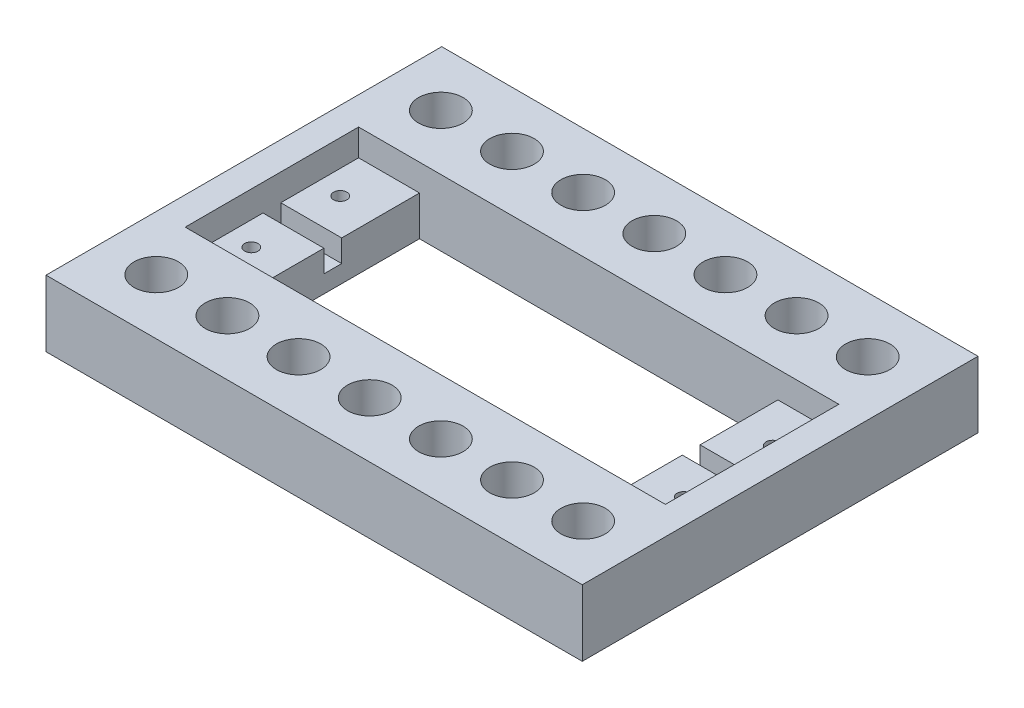
from build123d import *

# Parameters (mm, degrees)
SKETCH1_W           = 60.3
SKETCH1_H           = 44.5
SKETCH1_R           = 0.75
SKETCH1_W_2         = 40.3
SKETCH1_H_2         = 19.5
BOSS_EXTRUDE1_DEPTH = 7.46
SKETCH3_W           = 54
SKETCH3_H           = 19.5
CUT_EXTRUDE1_DEPTH  = 3
SKETCH4_R           = 2.5
CUT_EXTRUDE2_DEPTH  = 39.206499447
SKETCH5_W           = 6.85
SKETCH5_H           = 2
CUT_EXTRUDE3_DEPTH  = 2.5


with BuildPart() as part:
    # Sketch1 → Boss-Extrude1 (new body)
    with BuildSketch(Plane(origin=(0, 0, 0), x_dir=(1, 0, 0), z_dir=(0, 1, 0))):
        Rectangle(SKETCH1_W, SKETCH1_H)
        with Locations((-24.315, -5)):
            Circle(SKETCH1_R, mode=Mode.SUBTRACT)
        with Locations((-24.315, 5)):
            Circle(SKETCH1_R, mode=Mode.SUBTRACT)
        with Locations((24.315, -5)):
            Circle(SKETCH1_R, mode=Mode.SUBTRACT)
        with Locations((24.315, 5)):
            Circle(SKETCH1_R, mode=Mode.SUBTRACT)
        Rectangle(SKETCH1_W_2, SKETCH1_H_2, mode=Mode.SUBTRACT)
    extrude(amount=BOSS_EXTRUDE1_DEPTH)

    # Sketch3 → Cut-Extrude1 (cut)
    with BuildSketch(Plane(origin=(0, 7.46, 0), x_dir=(1, 0, 0), z_dir=(0, 1, 0))):
        Rectangle(SKETCH3_W, SKETCH3_H)
    extrude(amount=-CUT_EXTRUDE1_DEPTH, mode=Mode.SUBTRACT)

    # Sketch4 → Cut-Extrude2 (cut, through all)
    with BuildSketch(Plane(origin=(0, 7.46, 0), x_dir=(1, 0, 0), z_dir=(0, 1, 0))):
        with Locations((0, 16)):
            Circle(SKETCH4_R)
        with Locations((8, 16)):
            Circle(SKETCH4_R)
        with Locations((16, 16)):
            Circle(SKETCH4_R)
        with Locations((24, 16)):
            Circle(SKETCH4_R)
        with Locations((-24, 16)):
            Circle(SKETCH4_R)
        with Locations((-16, 16)):
            Circle(SKETCH4_R)
        with Locations((-8, 16)):
            Circle(SKETCH4_R)
        with Locations((24, -16)):
            Circle(SKETCH4_R)
        with Locations((16, -16)):
            Circle(SKETCH4_R)
        with Locations((8, -16)):
            Circle(SKETCH4_R)
        with Locations((0, -16)):
            Circle(SKETCH4_R)
        with Locations((-8, -16)):
            Circle(SKETCH4_R)
        with Locations((-16, -16)):
            Circle(SKETCH4_R)
        with Locations((-24, -16)):
            Circle(SKETCH4_R)
    extrude(amount=-CUT_EXTRUDE2_DEPTH, mode=Mode.SUBTRACT)

    # Sketch5 → Cut-Extrude3 (cut)
    with BuildSketch(Plane(origin=(0, 4.46, 0), x_dir=(1, 0, 0), z_dir=(0, 1, 0))):
        with Locations((-23.575, 0)):
            Rectangle(SKETCH5_W, SKETCH5_H)
        with Locations((23.575, 0)):
            Rectangle(SKETCH5_W, SKETCH5_H)
    extrude(amount=-CUT_EXTRUDE3_DEPTH, mode=Mode.SUBTRACT)


solid = part.part
